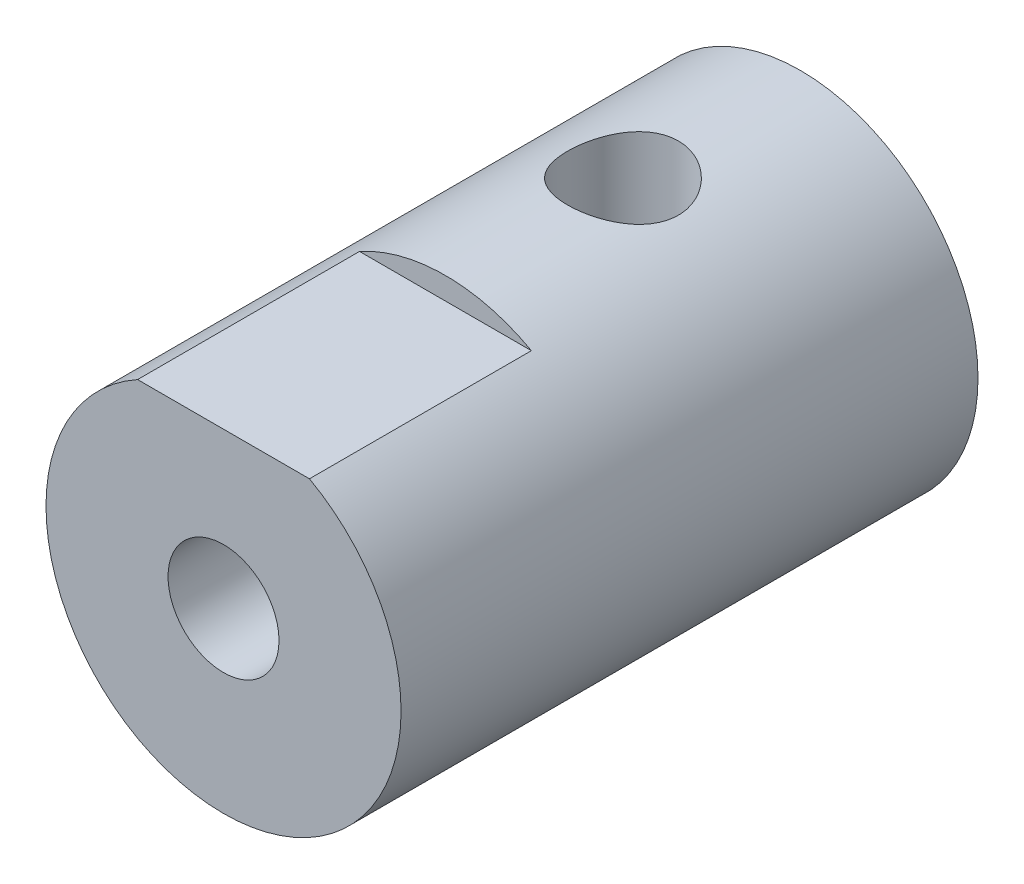
from build123d import *

# Parameters (mm, degrees)
BOSS_EXTRUDE1_DEPTH    = 5
BOSS_EXTRUDE2_START    = 8
SKETCH2_R              = 4
BOSS_EXTRUDE2_DEPTH    = 8
CUT_EXTRUDE1_DEPTH     = 8
SKETCH4_R              = 1.25
CUT_EXTRUDE2_DEPTH     = 8
CUT_EXTRUDE3_START     = -2.5
CUT_EXTRUDE3_OUTLINE_R = 1.25
CUT_EXTRUDE3_DEPTH     = 2.5


# Read off the part's stored shape, not the designer's step: Cut-Extrude3
with BuildPart() as part:
    # Sketch1 → Boss-Extrude1 (new body)
    with BuildSketch(Plane.XY):
        with BuildLine():
            Line((-1.936491673, 3.5), (1.936491673, 3.5))
            ThreePointArc((1.936491673, 3.5), (0, -4), (-1.936491673, 3.5))
        make_face()
    extrude(amount=BOSS_EXTRUDE1_DEPTH)

    # Sketch2 → Boss-Extrude2 (add)
    with BuildSketch(Plane(origin=(0, 0, 0), x_dir=(-1, 0, 0), z_dir=(0, 0, -1)).offset(BOSS_EXTRUDE2_START)):
        Circle(SKETCH2_R)
    extrude(amount=-BOSS_EXTRUDE2_DEPTH)

    # Sketch3 → Cut-Extrude1 (cut)
    with BuildSketch(Plane(origin=(0, 0, -8), x_dir=(-1, 0, 0), z_dir=(0, 0, -1))):
        with BuildLine():
            Line((-1.322875656, 1.5), (1.322875656, 1.5))
            ThreePointArc((1.322875656, 1.5), (0, -2), (-1.322875656, 1.5))
        make_face()
    extrude(amount=-CUT_EXTRUDE1_DEPTH, mode=Mode.SUBTRACT)

    # Sketch4 → Cut-Extrude2 (cut)
    with BuildSketch(Plane.XY.offset(5)):
        Circle(SKETCH4_R)
    extrude(amount=-CUT_EXTRUDE2_DEPTH, mode=Mode.SUBTRACT)

    # Cut-Extrude3 outline → Cut-Extrude3 (cut)
    with BuildSketch(Plane(origin=(0, 4, 0), x_dir=(1, 0, 0), z_dir=(0, 1, 0)).offset(CUT_EXTRUDE3_START)):
        with Locations((0, 4)):
            Circle(CUT_EXTRUDE3_OUTLINE_R)
    extrude(amount=CUT_EXTRUDE3_DEPTH, mode=Mode.SUBTRACT)


solid = part.part
